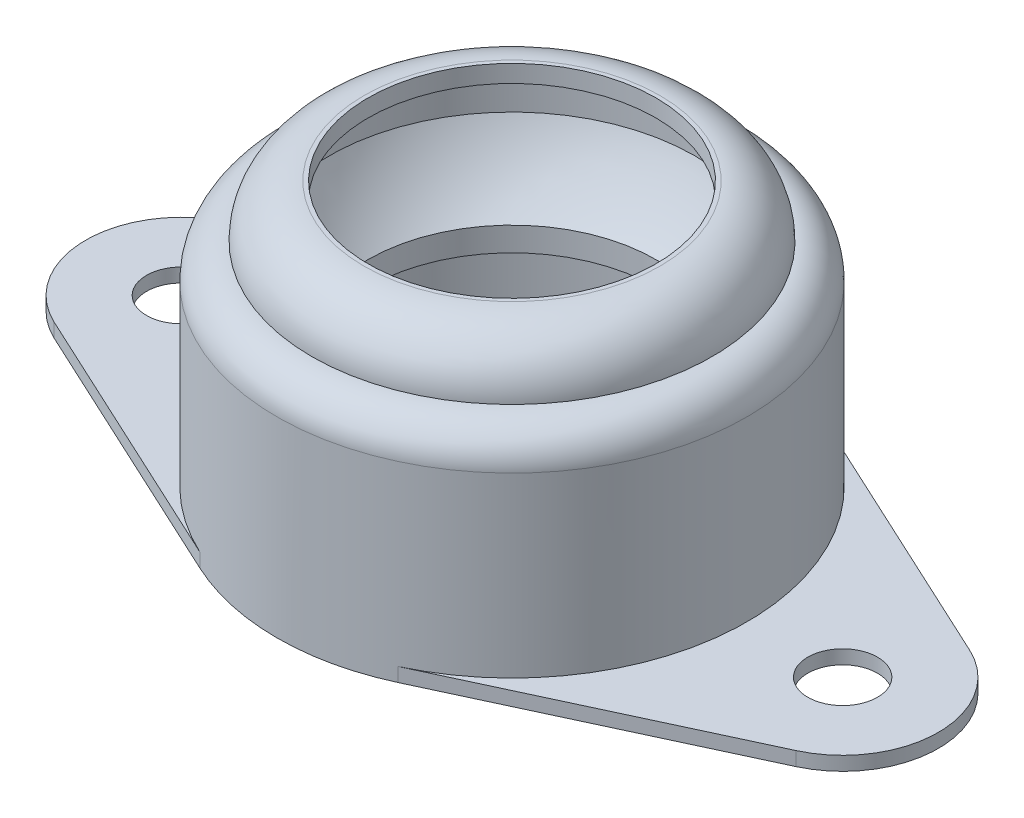
from build123d import *
from build123d.topology import SkipClean

# Parameters (mm, degrees)
FILLET_1_R          = 2
FILLET_2_R          = 3
EXTRUDE_START       = -0.8
SKETCH_2_R          = 2
EXTRUDE_1_DEPTH     = 0.8
FILLET_3_R          = 1
SKETCH_5_R          = 8.269115691
CUT_EXTRUDE_1_DEPTH = 15


with BuildPart() as part:
    # 草图1 → 旋转1 (revolve)
    with BuildSketch(Plane.XY, mode=Mode.PRIVATE) as revolve_1_sk:
        with BuildLine():
            Line((0, 1), (0, 0))
            Line((0, 0), (13.5, 0))
            Line((13.5, 0), (13.5, 13))
            Line((13.5, 13), (11.5, 13))
            Line((11.5, 13), (11.5, 16))
            Line((11.5, 16), (8.000244137, 16))
            ThreePointArc((8.000244137, 16), (5.65702688, 21.65702688), (0, 24.000244137))
            Line((0, 24.000244137), (0, 7.999755863))
            ThreePointArc((0, 7.999755863), (5.291675638, 9.99982707), (7.9375, 15))
            Line((7.9375, 15), (10.5, 15))
            Line((10.5, 15), (10.5, 12))
            Line((10.5, 12), (12.5, 12))
            Line((12.5, 12), (12.5, 1))
            Line((12.5, 1), (0, 1))
        make_face()
    revolve(revolve_1_sk.sketch.rotate(Axis((0, 30.588447592, 0), (0, -1, 0)), 90), axis=Axis((0, 30.588447592, 0), (0, -1, 0)))

    # 圆角1
    fillet_1_edges = [part.edges().sort_by_distance(p)[0] for p in [
        (0, 13, -13.5),
    ]]
    fillet(fillet_1_edges, radius=FILLET_1_R - 0.0001)  # a hair under: the kernel refuses the full size

    # 圆角2
    fillet_2_edges = [part.edges().sort_by_distance(p)[0] for p in [
        (0, 16, -11.5),
    ]]
    fillet(fillet_2_edges, radius=FILLET_2_R - 0.0001)  # a hair under: the kernel refuses the full size

    # 草图2 → 凸台-拉伸1 (add)
    # profile 1 of 2: a face of its own
    with BuildSketch(Plane.XZ.offset(EXTRUDE_START)):
        with BuildLine():
            ThreePointArc((-5.684210526, -12.244988799), (-13.5, 0), (-5.684210526, 12.244988799))
            Line((-5.684210526, 12.244988799), (-21.315789474, 4.98869914))
            ThreePointArc((-21.315789474, 4.98869914), (-24.5, 0), (-21.315789474, -4.98869914))
            Line((-21.315789474, -4.98869914), (-5.684210526, -12.244988799))
        make_face()
        with Locations(Location((-19, 0, 0), (0, 0, 270))):
            Circle(SKETCH_2_R, mode=Mode.SUBTRACT)
    # profile 2 of 2: a face of its own
    with BuildSketch(Plane.XZ.offset(EXTRUDE_START)):
        with BuildLine():
            Line((21.315789474, 4.98869914), (5.684210526, 12.244988799))
            ThreePointArc((5.684210526, 12.244988799), (11.379517611, 7.263372422), (13.5, 0))
            ThreePointArc((13.5, 0), (11.379517611, -7.263372422), (5.684210526, -12.244988799))
            Line((5.684210526, -12.244988799), (21.315789474, -4.98869914))
            ThreePointArc((21.315789474, -4.98869914), (24.5, 0), (21.315789474, 4.98869914))
        make_face()
        with Locations(Location((19, 0, 0), (0, 0, 270))):
            Circle(SKETCH_2_R, mode=Mode.SUBTRACT)
    extrude(amount=EXTRUDE_1_DEPTH)

    # 草图3 → 切除-旋转1 (revolve, cut)
    with SkipClean():  # the faces are left unmerged after this step: merging them gives an invalid solid
        with BuildSketch(Plane.XY):
            with BuildLine():
                Line((0, 0), (12.5, 0))
                Line((12.5, 0), (12.5, 10.5))
                ThreePointArc((12.5, 10.5), (12.353553391, 10.853553391), (12, 11))
                Line((12, 11), (11.823279418, 11))
                ThreePointArc((11.823279418, 11), (11.554434948, 10.921571643), (11.369930597, 10.710890602))
                ThreePointArc((11.369930597, 10.710890602), (6.742585023, 5.427036971), (0, 3.460063796))
                Line((0, 3.460063796), (0, 0))
            make_face()
        revolve(axis=Axis((0, 3.460063796, 0), (0, -1, 0)), mode=Mode.SUBTRACT)

    # 草图4 → 旋转2 (revolve)
    with SkipClean():  # the faces are left unmerged after this step: merging them gives an invalid solid
        with BuildSketch(Plane.XY, mode=Mode.PRIVATE) as revolve_2_sk:
            with BuildLine():
                ThreePointArc((0, 4.460063796), (6.63523651, 6.558402463), (10.857466035, 12.090324963))
                Line((10.857466035, 12.090324963), (10.857466035, 11.174722069))
                Line((10.857466035, 11.174722069), (12.5, 11.174722069))
                Line((12.5, 11.174722069), (12.5, 10.5))
                ThreePointArc((12.5, 10.5), (12.353553391, 10.853553391), (12, 11))
                Line((12, 11), (11.823279418, 11))
                ThreePointArc((11.823279418, 11), (11.554434948, 10.921571643), (11.369930597, 10.710890602))
                ThreePointArc((11.369930597, 10.710890602), (6.742585023, 5.427036971), (0, 3.460063796))
                Line((0, 3.460063796), (0, 4.460063796))
            make_face()
        revolve(revolve_2_sk.sketch.rotate(Axis((0, 3.460063796, 0), (0, 1, 0)), 90), axis=Axis((0, 3.460063796, 0), (0, 1, 0)))

    # 圆角3
    fillet_3_edges = [part.edges().sort_by_distance(p)[0] for p in [
        (-12.5, 0, 0),
    ]]
    fillet(fillet_3_edges, radius=FILLET_3_R - 0.0001)  # a hair under: the kernel refuses the full size

    # 草图5 → 切除-拉伸1 (cut, symmetric)
    with BuildSketch(Plane(origin=(0, 16, 0), x_dir=(1, 0, 0), z_dir=(0, 1, 0))):
        with Locations(Location((0, 0, 0), (0, 0, 180))):
            Circle(SKETCH_5_R)
    extrude(amount=CUT_EXTRUDE_1_DEPTH, both=True, mode=Mode.SUBTRACT)


solid = part.part
